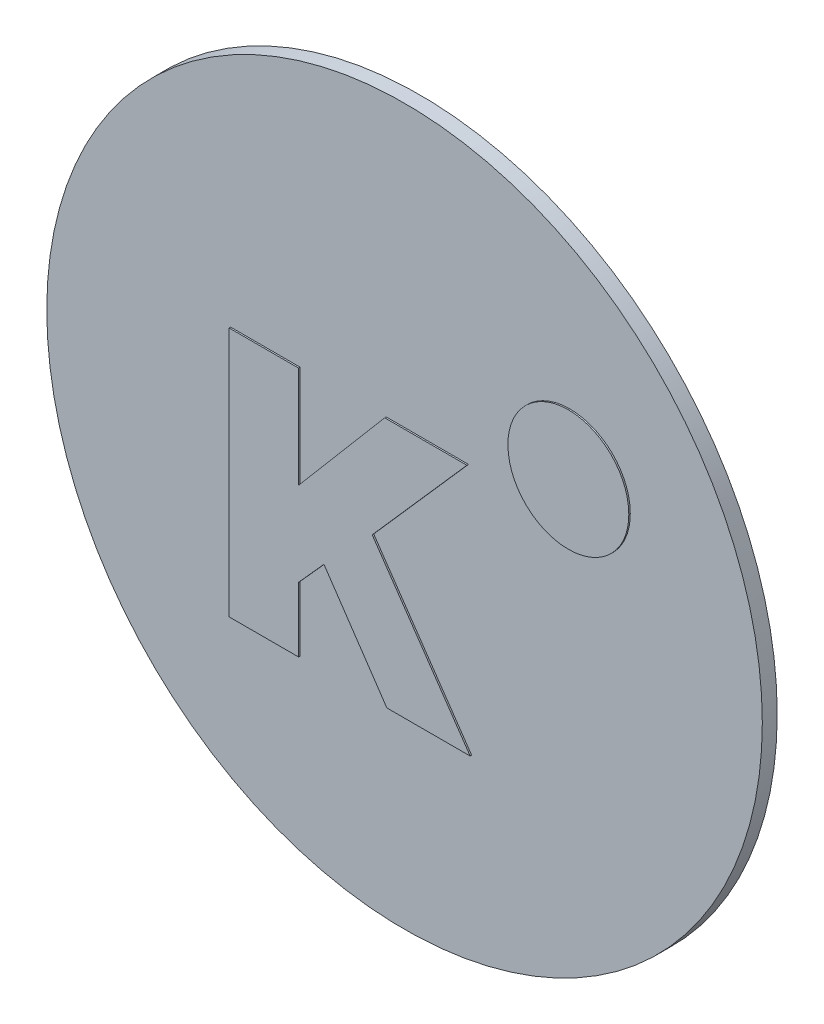
from build123d import *

# Parameters (mm, degrees)
SKETCH_1_R        = 24
EXTRUDE_1_DEPTH   = 1
EXTRUDE_2_DEPTH   = 0.1
EXTRUDE_2_2_DEPTH = 0.1


with BuildPart() as part:
    # Эскиз1 → Бобышка-Вытянуть1 (new body)
    with BuildSketch(Plane.XY):
        Circle(SKETCH_1_R)
    extrude(amount=EXTRUDE_1_DEPTH)


with BuildPart() as body_2:
    # Эскиз2 → Бобышка-Вытянуть2 (new body)
    with BuildSketch(Plane.XY.offset(1)):
        with BuildLine():
            Line((7.03716803, 7.707099465), (7.03716803, 7.755283265))
            add(Edge.make_bspline(
                [(7.03716803, 7.755283265), (7.03716803, 9.98496194), (8.859240205, 11.783142239), (11.088896654, 11.783142239)],
                knots=[1, 1, 1, 1, 2, 2, 2, 2], degree=3))
            add(Edge.make_bspline(
                [(11.088896654, 11.783142239), (13.318775354, 11.783142239), (15.141047553, 9.98496194), (15.141047553, 7.755283265)],
                knots=[2, 2, 2, 2, 3, 3, 3, 3], degree=3))
            Line((15.141047553, 7.755283265), (15.141047553, 7.707099465))
            add(Edge.make_bspline(
                [(15.141047553, 7.707099465), (15.141047553, 5.477443016), (13.318775354, 3.679262716), (11.088896654, 3.679262716)],
                knots=[4, 4, 4, 4, 5, 5, 5, 5], degree=3))
            add(Edge.make_bspline(
                [(11.088896654, 3.679262716), (8.859240205, 3.679262716), (7.03716803, 5.477443016), (7.03716803, 7.707099465)],
                knots=[5, 5, 5, 5, 6, 6, 6, 6], degree=3))
        make_face()
    extrude(amount=EXTRUDE_2_DEPTH)


with BuildPart() as body_3:
    # Эскиз2 → Extrude 2 2 (new body)
    with BuildSketch(Plane.XY.offset(1)):
        Polygon((-11.659613215, 5.157314116), (-7.008409666, 5.157314116), (-7.008409666, -1.651914707), (-1.229909668, 5.157314116), (4.284668456, 5.157314116), (-2.068992317, -2.059521207), (4.500406531, -11.626050205), (-1.086247268, -11.626050205), (-5.305952442, -5.392182181), (-7.008409666, -7.286307806), (-7.008409666, -11.626050205), (-11.659613215, -11.626050205), align=None)
    extrude(amount=EXTRUDE_2_2_DEPTH)


solid = Compound([part.part, body_2.part, body_3.part])
